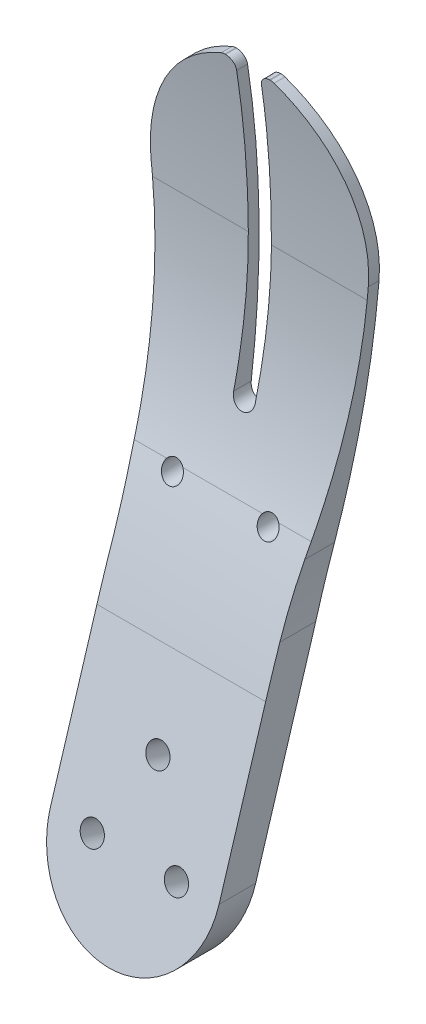
from build123d import *

# Parameters (mm, degrees)
BOSS_EXTRUDE1_DEPTH      = 10
BOSS_EXTRUDE1_DEPTH_BACK = 170
CUT_EXTRUDE1_START       = -56.596276098
CUT_EXTRUDE1_DEPTH       = 63.852366254
SKETCH4_R                = 3
CUT_EXTRUDE2_DEPTH       = 138
IZIM1_R                  = 3.4
KES_EKSTR_ZYON1_DEPTH    = 30


# Read off the part's stored shape, not the designer's step: Cut-Extrude1
with BuildPart() as part:
    # Sketch2 → Boss-Extrude1 (new, two sides: drawn at the far end of the back side and taken through both)
    with BuildSketch(Plane.XY.offset(-BOSS_EXTRUDE1_DEPTH_BACK)):
        with BuildLine():
            add(Edge.make_bspline(
                [(713.115400438, 967.929548674), (713.040487985, 973.083917524), (712.761930408, 978.181490004), (712.282598709, 983.268672633)],
                knots=[0, 0, 0, 0, 1, 1, 1, 1], degree=3))
            add(Edge.make_bspline(
                [(706.061234974, 1049.296464211), (706.592900848, 1043.653855128), (707.122802507, 1038.02996979), (707.914019075, 1029.632730073), (708.17714905, 1026.840112263), (708.5707833, 1022.662442968), (708.701817753, 1021.271764676), (708.963505642, 1018.494451827), (709.094237505, 1017.106984939), (709.746042518, 1010.189330321), (710.258543368, 1004.750121056), (711.274880674, 993.963658362), (711.778700503, 988.616581407), (712.282598709, 983.268672633)],
                knots=[0, 0, 0, 0, 0.25, 0.25, 0.375, 0.375, 0.4375, 0.4375, 0.5, 0.5, 0.75, 0.75, 1, 1, 1, 1], degree=3))
            add(Edge.make_bspline(
                [(730.081597513, 1090.629819361), (728.126017649, 1089.747156187), (726.266492123, 1088.724775538), (722.730175459, 1086.412970813), (721.053408041, 1085.123519331), (719.074342676, 1083.339910253), (718.683603442, 1082.973751075), (717.918390279, 1082.228069166), (717.544247265, 1081.848944233), (716.446777453, 1080.693005976), (715.748371369, 1079.89765784), (713.75089012, 1077.438665241), (712.548956998, 1075.70251969), (711.211159624, 1073.408597505), (710.951878553, 1072.943590418), (710.450131744, 1072.000914781), (710.207375987, 1071.522554026), (709.510626418, 1070.080564806), (709.086097287, 1069.10653033), (707.929517154, 1066.14708104), (707.31377791, 1064.124538366), (706.624586107, 1061.015400006), (706.434097773, 1059.966412458), (706.134066708, 1057.84236397), (706.025726614, 1056.774438258), (705.82655755, 1053.574528234), (705.85950406, 1051.437449258), (706.061234974, 1049.296464211)],
                knots=[0, 0, 0, 0, 0.125, 0.125, 0.25, 0.25, 0.28125, 0.28125, 0.3125, 0.3125, 0.375, 0.375, 0.5, 0.5, 0.53125, 0.53125, 0.5625, 0.5625, 0.625, 0.625, 0.75, 0.75, 0.8125, 0.8125, 0.875, 0.875, 1, 1, 1, 1], degree=3))
            add(Edge.make_bspline(
                [(731.275608034, 1090.886799517), (731.071545531, 1090.886799517), (730.864330277, 1090.864801394), (730.463937437, 1090.778509215), (730.269712282, 1090.714726136), (730.081597513, 1090.629819361)],
                knots=[0, 0, 0, 0, 0.5, 0.5, 1, 1, 1, 1], degree=3))
            add(Edge.make_bspline(
                [(734.177972069, 1087.984435482), (734.177972069, 1088.175195994), (734.159348257, 1088.362800496), (734.086360712, 1088.731956145), (734.031161814, 1088.915345522), (733.88662303, 1089.265946633), (733.798121187, 1089.432333612), (733.588902386, 1089.747430333), (733.466830843, 1089.897065828), (733.199589856, 1090.165698003), (733.053695518, 1090.286302119), (732.736761174, 1090.499433815), (732.566839221, 1090.590676692), (732.216273573, 1090.736692659), (732.033306121, 1090.792759884), (731.655676878, 1090.868241996), (731.466040135, 1090.886799517), (731.275608034, 1090.886799517)],
                knots=[0, 0, 0, 0, 0.125, 0.125, 0.25, 0.25, 0.375, 0.375, 0.5, 0.5, 0.625, 0.625, 0.75, 0.75, 0.875, 0.875, 1, 1, 1, 1], degree=3))
            Line((734.177972069, 1087.984435482), (734.654428795, 1007.662827804))
            ThreePointArc((734.654428795, 1007.662827804), (737.805927113, 1004.511329486), (740.957425431, 1007.662827804))
            Line((740.957425431, 1007.662827804), (741.433882157, 1087.984435482))
            add(Edge.make_bspline(
                [(744.336246192, 1090.886799517), (744.145462191, 1090.886799517), (743.95613827, 1090.868170252), (743.580445649, 1090.793202791), (743.395654511, 1090.736719613), (743.04504034, 1090.590691052), (742.876472951, 1090.500289119), (742.558290355, 1090.286462954), (742.412247991, 1090.165665981), (742.145277012, 1089.897336322), (742.023339263, 1089.747970269), (741.813753602, 1089.432408044), (741.725293165, 1089.266022701), (741.580960916, 1088.916070901), (741.525582294, 1088.732339178), (741.452493685, 1088.362804301), (741.433882157, 1088.175129446), (741.433882157, 1087.984435482)],
                knots=[0, 0, 0, 0, 0.125, 0.125, 0.25, 0.25, 0.375, 0.375, 0.5, 0.5, 0.625, 0.625, 0.75, 0.75, 0.875, 0.875, 1, 1, 1, 1], degree=3))
            add(Edge.make_bspline(
                [(745.530256712, 1090.629819361), (745.341938759, 1090.714817844), (745.147863256, 1090.778483495), (744.748588127, 1090.864609207), (744.540983464, 1090.886799517), (744.336246192, 1090.886799517)],
                knots=[0, 0, 0, 0, 0.5, 0.5, 1, 1, 1, 1], degree=3))
            add(Edge.make_bspline(
                [(769.550619252, 1049.296464211), (769.752331903, 1051.437255439), (769.784421701, 1053.564604001), (769.524161099, 1057.793669774), (769.231781356, 1059.895384551), (768.657676372, 1062.506179855), (768.532049484, 1063.028635241), (768.261511209, 1064.064197737), (768.116567157, 1064.577694687), (767.653184917, 1066.10556148), (767.306240628, 1067.107326443), (766.153462887, 1070.063282243), (765.23636666, 1071.968428733), (763.633882832, 1074.726896498), (763.059035409, 1075.633399311), (761.848839257, 1077.386726846), (761.213023802, 1078.235140039), (759.215419314, 1080.697747782), (757.764013267, 1082.229806336), (755.405295784, 1084.362562463), (754.587796286, 1085.046462805), (752.8934756, 1086.354442848), (752.024435582, 1086.97261936), (749.352611096, 1088.721529138), (747.485520423, 1089.747298885), (745.530256712, 1090.629819361)],
                knots=[0, 0, 0, 0, 0.125, 0.125, 0.25, 0.25, 0.28125, 0.28125, 0.3125, 0.3125, 0.375, 0.375, 0.5, 0.5, 0.5625, 0.5625, 0.625, 0.625, 0.75, 0.75, 0.8125, 0.8125, 0.875, 0.875, 1, 1, 1, 1], degree=3))
            add(Edge.make_bspline(
                [(769.550619252, 1049.296464211), (769.018953378, 1043.653855128), (768.489051719, 1038.02996979), (767.697835151, 1029.632730073), (767.434705175, 1026.840112263), (767.041070925, 1022.662442968), (766.910036473, 1021.271764676), (766.648348583, 1018.494451827), (766.51761672, 1017.106984939), (765.865811707, 1010.189330321), (765.353310858, 1004.750121056), (764.336973551, 993.963658362), (763.833153722, 988.616581407), (763.329255517, 983.268672633)],
                knots=[0, 0, 0, 0, 0.25, 0.25, 0.375, 0.375, 0.4375, 0.4375, 0.5, 0.5, 0.75, 0.75, 1, 1, 1, 1], degree=3))
            add(Edge.make_bspline(
                [(763.329255517, 983.268672633), (762.762744363, 977.256248034), (762.476021411, 971.231315541), (762.476021411, 965.117691328)],
                knots=[0, 0, 0, 0, 1, 1, 1, 1], degree=3))
            Line((762.476021411, 965.117691328), (762.476021411, 933.923460009))
            Line((762.476021411, 933.923460009), (762.476021411, 907.554137965))
            ThreePointArc((762.476021411, 907.554137965), (737.805927113, 882.884043666), (713.135832814, 907.554137965))
            Line((713.135832814, 907.554137965), (713.126908851, 933.923460009))
            Line((713.126908851, 933.923460009), (713.121630442, 949.520575669))
            Line((713.121630442, 949.520575669), (713.116352033, 965.117691328))
            add(Edge.make_bspline(
                [(713.115400438, 967.929548674), (713.115717121, 966.993784718), (713.116034289, 966.056587088), (713.116352033, 965.117691328)],
                knots=[0, 0, 0, 0, 1, 1, 1, 1], degree=3))
        make_face()
    extrude(amount=BOSS_EXTRUDE1_DEPTH + BOSS_EXTRUDE1_DEPTH_BACK)

    # Cut-Extrude1 outline → Cut-Extrude1 (cut)
    with BuildSketch(Plane(origin=(762.476021411, 0, 0), x_dir=(0, 0, -1), z_dir=(1, 0, 0)).offset(CUT_EXTRUDE1_START)):
        with BuildLine():
            Line((82.425096597, 1090.884043764), (85.616300672, 1090.884043764))
            ThreePointArc((85.616300672, 1090.884043764), (88.465320674, 1025.550123335), (76.546691724, 961.249389611))
            Line((76.546691724, 961.249389611), (52.588001106, 882.884043666))
            Line((52.588001106, 882.884043666), (52.011991152, 881))
            Line((52.011991152, 881), (170, 881))
            Line((170, 881), (170, 1092))
            Line((170, 1092), (-10, 1092))
            Line((-10, 1092), (-10, 881))
            Line((-10, 881), (41.30157255, 881))
            Line((41.30157255, 881), (41.877582504, 882.884043666))
            Line((41.877582504, 882.884043666), (63.041200233, 952.107118129))
            ThreePointArc((63.041200233, 952.107118129), (68.78500943, 969.77098609), (75.149769154, 987.220725604))
            ThreePointArc((75.149769154, 987.220725604), (83.278070897, 1015.96593521), (86.018247077, 1045.712326571))
            ThreePointArc((86.018247077, 1045.712326571), (85.118543003, 1068.369526114), (82.425096597, 1090.884043764))
        make_face()
    extrude(amount=CUT_EXTRUDE1_DEPTH, mode=Mode.SUBTRACT)

    # Sketch4 → Cut-Extrude2 (cut)
    with BuildSketch(Plane.XY):
        with Locations((723.805927113, 985.384043666)):
            Circle(SKETCH4_R)
        with Locations((751.805927113, 985.384043666)):
            Circle(SKETCH4_R)
    extrude(amount=-CUT_EXTRUDE2_DEPTH, mode=Mode.SUBTRACT)

    # Çizim1 → Kes-Ekstrüzyon1 (cut, symmetric)
    with BuildSketch(Plane(origin=(0, 63.761176153, 208.553409979), x_dir=(1, 0, 0), z_dir=(-1.2309675530727095e-14, 0.29237170472272156, 0.9563047559630402))):
        with Locations(Location((737.805927113, 905.534444519, 0), (0, 0, 270))):
            Circle(IZIM1_R)
        with Locations(Location((750.116024025, 881.955046739, 0), (0, 0, 270))):
            Circle(IZIM1_R)
        with Locations(Location((725.4958302, 881.955046739, 0), (0, 0, 270))):
            Circle(IZIM1_R)
    extrude(amount=KES_EKSTR_ZYON1_DEPTH, both=True, mode=Mode.SUBTRACT)


solid = part.part
